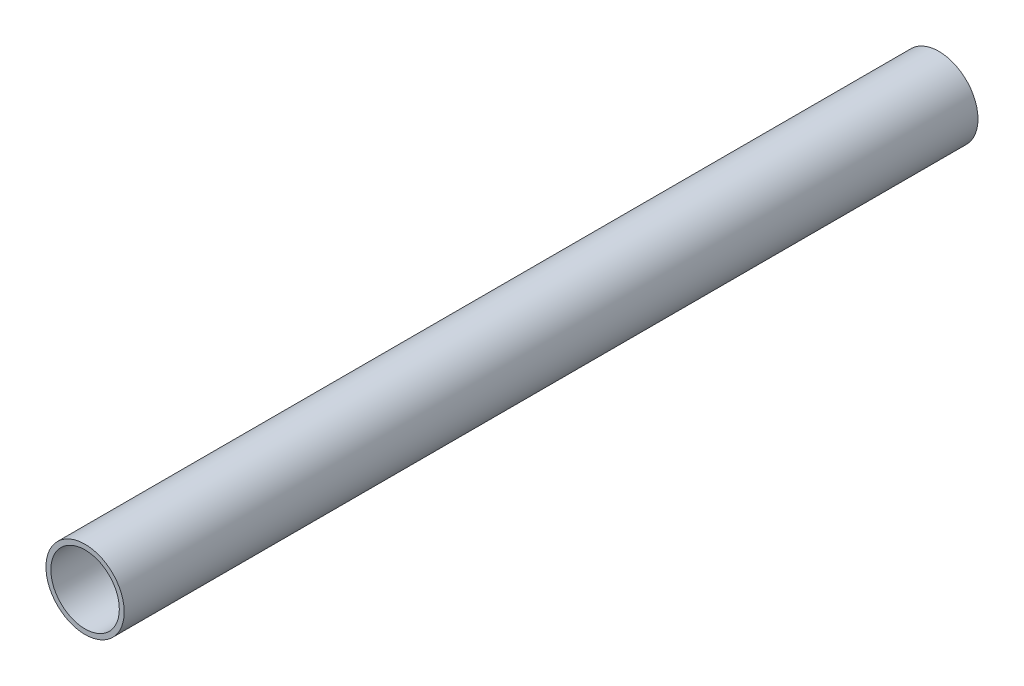
from build123d import *

# Parameters (mm, degrees)
SKETCH1_R           = 25.4
SKETCH1_R_2         = 22.225
BOSS_EXTRUDE1_DEPTH = 277.00605


with BuildPart() as part:
    # Sketch1 → Boss-Extrude1 (new, symmetric)
    with BuildSketch(Plane.XY):
        Circle(SKETCH1_R)
        Circle(SKETCH1_R_2, mode=Mode.SUBTRACT)
    extrude(amount=BOSS_EXTRUDE1_DEPTH, both=True)


solid = part.part
